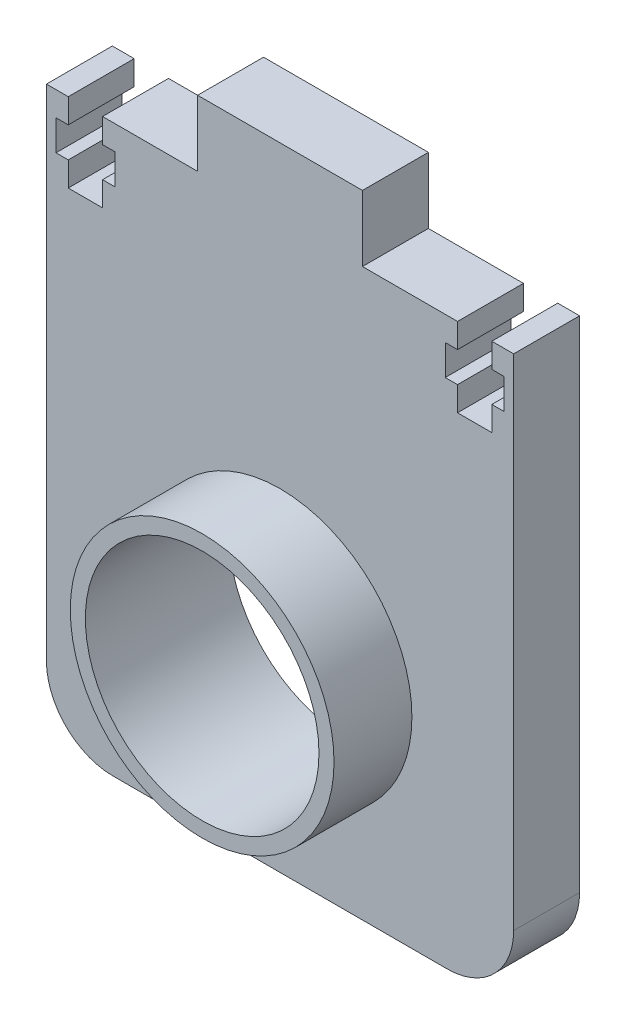
from build123d import *

# Parameters (mm, degrees)
SKETCH12_W           = 90
SKETCH12_H           = 121.71
BOSS_EXTRUDE10_DEPTH = 12.7
SKETCH15_R           = 25.4
BOSS_EXTRUDE11_DEPTH = 15
SKETCH23_R           = 22.5
CUT_EXTRUDE7_DEPTH   = 197.78132062
FILLET2_R            = 12.8
SKETCH25_W           = 29.125
SKETCH25_H           = 12.7
CUT_EXTRUDE9_DEPTH   = 196.39856229
CUT_EXTRUDE10_DEPTH  = 196.39856229


with BuildPart() as part:
    # Sketch12 → Boss-Extrude10 (new body)
    with BuildSketch(Plane.XY):
        with Locations((107.125849364, 60.855)):
            Rectangle(SKETCH12_W, SKETCH12_H)
    extrude(amount=BOSS_EXTRUDE10_DEPTH)

    # Sketch15 → Boss-Extrude11 (add)
    with BuildSketch(Plane.XY.offset(12.7)):
        with Locations((107.125849364, 38.627603634)):
            Circle(SKETCH15_R)
    extrude(amount=BOSS_EXTRUDE11_DEPTH)

    # Sketch23 → Cut-Extrude7 (cut, through all)
    with BuildSketch(Plane.XY.offset(27.7)):
        with Locations((107.125849364, 38.627603634)):
            Circle(SKETCH23_R)
    extrude(amount=-CUT_EXTRUDE7_DEPTH, mode=Mode.SUBTRACT)

    # Fillet2
    fillet2_edges = [part.edges().sort_by_distance(p)[0] for p in [
        (152.125849364, 0, 6.35),
        (62.125849364, 0, 6.35),
    ]]
    fillet(fillet2_edges, radius=FILLET2_R)

    # Sketch25 → Cut-Extrude9 (cut, through all)
    with BuildSketch(Plane.XY.offset(12.7)):
        with Locations((137.563349364, 115.36)):
            Rectangle(SKETCH25_W, SKETCH25_H)
        with Locations((76.688349364, 115.36)):
            Rectangle(SKETCH25_W, SKETCH25_H)
    extrude(amount=-CUT_EXTRUDE9_DEPTH, mode=Mode.SUBTRACT)

    # Sketch27 → Cut-Extrude10 (cut, through all)
    with BuildSketch(Plane.XY.offset(12.7)):
        Polygon((147.917849364, 109.01), (147.917849364, 104.311), (150.279849364, 104.311), (150.279849364, 98.469), (147.917849364, 98.469), (147.917849364, 93.77), (141.313849364, 93.77), (141.313849364, 98.469), (138.951849364, 98.469), (138.951849364, 104.311), (141.313849364, 104.311), (141.313849364, 109.01), align=None)
        Polygon((72.937849364, 98.469), (75.299849364, 98.469), (75.299849364, 104.311), (72.937849364, 104.311), (72.937849364, 109.01), (66.333849364, 109.01), (66.333849364, 104.311), (63.971849364, 104.311), (63.971849364, 98.469), (66.333849364, 98.469), (66.333849364, 93.77), (72.937849364, 93.77), align=None)
    extrude(amount=-CUT_EXTRUDE10_DEPTH, mode=Mode.SUBTRACT)


solid = part.part
